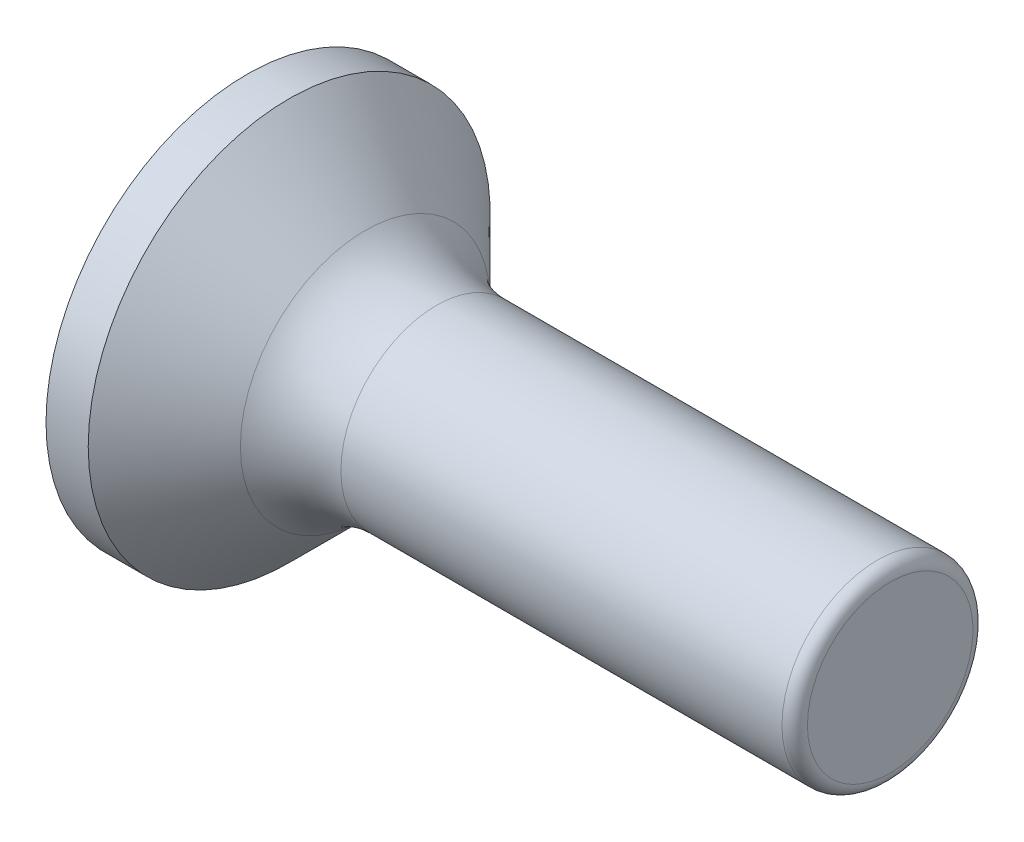
from build123d import *

# Parameters (mm, degrees)
CUT_EXTRUDE1_DEPTH = 2.942766955
DRAFT1_ANGLE       = 30
FILLET1_R          = 0.633333333


with BuildPart() as part:
    # Sketch1 → Base (revolve)
    with BuildSketch(Plane.XY):
        with BuildLine():
            Line((32, 0), (32, 4.75))
            Line((32, 4.75), (9.421067816, 4.75))
            ThreePointArc((9.421067816, 4.75), (7.507650654, 5.130602337), (5.88553391, 6.214466094))
            Line((5.88553391, 6.214466094), (2.100000004, 10))
            Line((2.100000004, 10), (0, 10))
            Line((0, 10), (0, 0))
            Line((0, 0), (32, 0))
        make_face()
    revolve(axis=Axis((-11.69614751, 0, 0), (1, 0, 0)))

    # Sketch2 → Cut-Extrude1 (cut)
    with BuildSketch(Plane(origin=(0, 0, 0), x_dir=(0, 0, -1), z_dir=(1, 0, 0))):
        Polygon((1, 5), (-1, 5), (-1, 1), (-5, 1), (-5, -1), (-1, -1), (-1, -5), (1, -5), (1, -1), (5, -1), (5, 1), (1, 1), align=None)
    extrude(amount=CUT_EXTRUDE1_DEPTH, mode=Mode.SUBTRACT)

    # Draft1
    draft1_faces = [part.faces().sort_by_distance(p)[0] for p in [
        (1.471383478, 0, -5),
        (1.471383478, 0, 5),
        (1.471383478, -5, 0),
        (1.471383478, 5, 0),
    ]]
    draft(draft1_faces, Plane(origin=(0, 10, 0), x_dir=(0, 0, -1), z_dir=(-1, 0, 0)), DRAFT1_ANGLE)

    # Fillet1
    fillet1_edges = [part.edges().sort_by_distance(p)[0] for p in [
        (32, -4.75, 0),
    ]]
    fillet(fillet1_edges, radius=FILLET1_R)


solid = part.part
